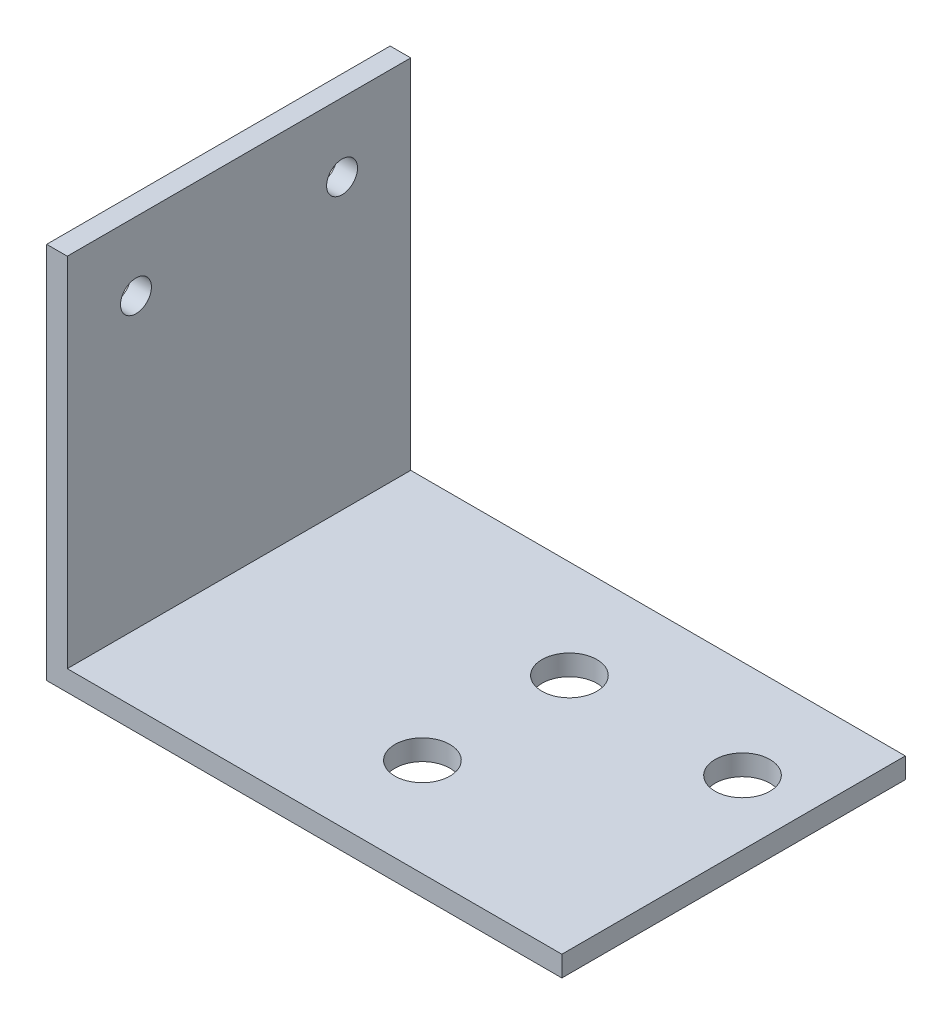
from build123d import *

# Parameters (mm, degrees)
EXTRUDE_1_DEPTH     = 50
SKETCH_6_R          = 2
CUT_EXTRUDE_2_DEPTH = 105.062481231
SKETCH1_R           = 2
CUT_EXTRUDE1_DEPTH  = 105.062481231
SKETCH2_R           = 4
CUT_EXTRUDE2_DEPTH  = 105.062481231
SKETCH4_R           = 2.25
CUT_EXTRUDE3_DEPTH  = 106.59356041


with BuildPart() as part:
    # Эскиз1 → Бобышка-Вытянуть1 (new body)
    with BuildSketch(Plane.XY):
        Polygon((0, 0), (75, 0), (75, 3), (3, 3), (3, 55), (0, 55), align=None)
    extrude(amount=EXTRUDE_1_DEPTH)

    # Эскиз6 → Вырез-Вытянуть2 (cut, through all)
    with BuildSketch(Plane(origin=(0, 3, 0), x_dir=(1, 0, 0), z_dir=(0, 1, 0))):
        with Locations((40.4, -14.3)):
            Circle(SKETCH_6_R)
        with Locations((40.4, -35.7)):
            Circle(SKETCH_6_R)
    extrude(amount=-CUT_EXTRUDE_2_DEPTH, mode=Mode.SUBTRACT)

    # Sketch1 → Cut-Extrude1 (cut, through all)
    with BuildSketch(Plane(origin=(0, 3, 0), x_dir=(1, 0, 0), z_dir=(0, 1, 0))):
        with Locations((65.6, -14.3)):
            Circle(SKETCH1_R)
    extrude(amount=-CUT_EXTRUDE1_DEPTH, mode=Mode.SUBTRACT)

    # Sketch2 → Cut-Extrude2 (cut, through all)
    with BuildSketch(Plane(origin=(0, 3, 0), x_dir=(1, 0, 0), z_dir=(0, 1, 0))):
        with Locations((40.4, -14.3)):
            Circle(SKETCH2_R)
        with Locations((65.6, -14.3)):
            Circle(SKETCH2_R)
        with Locations((40.4, -35.7)):
            Circle(SKETCH2_R)
    extrude(amount=-CUT_EXTRUDE2_DEPTH, mode=Mode.SUBTRACT)

    # Sketch4 → Cut-Extrude3 (cut, through all)
    with BuildSketch(Plane.ZY):
        with Locations((10, 45)):
            Circle(SKETCH4_R)
        with Locations((40, 45)):
            Circle(SKETCH4_R)
    extrude(amount=-CUT_EXTRUDE3_DEPTH, mode=Mode.SUBTRACT)


solid = part.part
